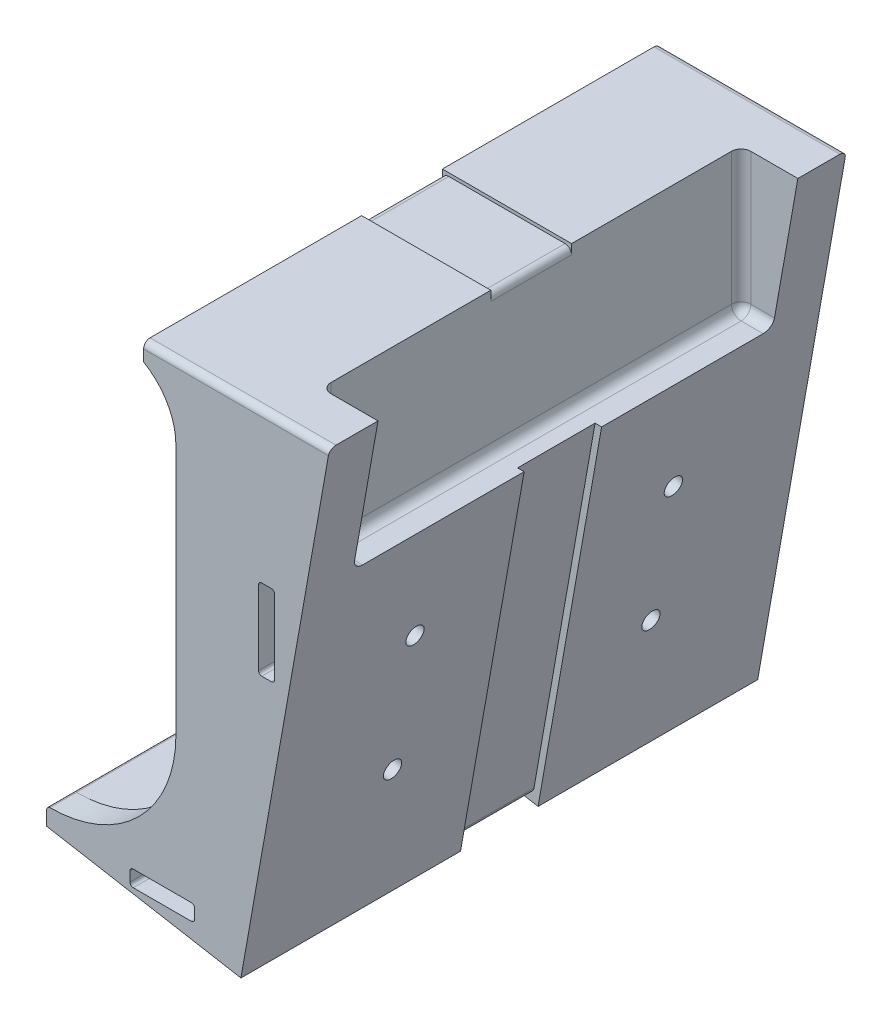
from build123d import *

# Parameters (mm, degrees)
BOSS_EXTRUDE1_DEPTH = 25.400000000000002
SKETCH2_W           = 203.19999999999993
SKETCH2_H           = 184.15
BOSS_EXTRUDE2_DEPTH = 38.1
CHAMFER1_SIZE       = 35.56
CHAMFER1_SIZE_2     = 201.670781506
CUT_EXTRUDE1_DEPTH  = 213.97755620753168
BOSS_EXTRUDE4_DEPTH = 50.800000000000004
FILLET3_R           = 49.53
FILLET4_R           = 1.2699999999999942
BOSS_EXTRUDE5_DEPTH = 203.2
CUT_EXTRUDE2_DEPTH  = 237.8088767802062
FILLET5_R           = 1.2699999999999942
CUT_EXTRUDE3_DEPTH  = 55.88
FILLET6_R           = 3.8099999999999943
SKETCH11_W          = 25.4
SKETCH11_H          = 6.349999999999994
CUT_EXTRUDE4_DEPTH  = 237.8088767802219
FILLET7_R           = 1.2699999999999942
SKETCH12_R          = 3.556000000000007
CUT_EXTRUDE5_DEPTH  = 171.34565336406357
CUT_EXTRUDE6_START  = -3.8099999999999996
SKETCH14_R          = 9.525
SKETCH14_R_2        = 6.350000000000002
CUT_EXTRUDE6_DEPTH  = 167.53565336406356
BOSS_EXTRUDE6_DEPTH = 6.985
FILLET8_R           = 2.54
FILLET9_R           = 25.4
FILLET10_R          = 2.54
FILLET11_START      = -88.646
FILLET11_3_DEPTH    = 177.292
SKETCH17_W          = 5.079999999999998
SKETCH17_H          = 30.480000000000004
CUT_EXTRUDE8_DEPTH  = 230.08767328741837
SKETCH18_W          = 80.83447075011952
SKETCH18_H          = 30.480000000000004
CUT_EXTRUDE9_DEPTH  = 2.54
FILLET12_R          = 2.5399999999999974
SKETCH19_W          = 128.64046005955743
SKETCH19_H          = 31.750000000000004
CUT_EXTRUDE10_DEPTH = 1.27
FILLET13_R          = 2.5399999999999974


with BuildPart() as part:
    # Sketch1 → Boss-Extrude1 (new body)
    with BuildSketch(Plane(origin=(0, 0, 0), x_dir=(0, 0, -1), z_dir=(1, 0, 0))):
        Polygon((-101.6, 92.07500000000002), (101.6, 92.07500000000002), (101.60000000000002, -92.07499999999999), (-101.59999999999997, -92.07499999999999), align=None)
        Polygon((-91.186, 85.09), (91.18599999999998, 85.09), (91.186, -85.09), (-91.18599999999999, -85.09), align=None, mode=Mode.SUBTRACT)
    extrude(amount=BOSS_EXTRUDE1_DEPTH)

    # Sketch2 → Boss-Extrude2 (add)
    with BuildSketch(Plane(origin=(25.400000000000002, 0, 0), x_dir=(0, 0, -1), z_dir=(1, 0, 0))):
        Rectangle(SKETCH2_W, SKETCH2_H)
    extrude(amount=BOSS_EXTRUDE2_DEPTH)

    # Chamfer1
    # the kernel refuses this chamfer: 201.670781506, 35.56 mm, written as the material it takes off along each edge
    with BuildSketch(Plane(origin=(63.5, -92.07499999999999, 625.6493498469063), x_dir=(-1, 0, 0), z_dir=(0, 0, -1))) as chamfer1_piece_1:
        Polygon((CHAMFER1_SIZE, 0), (0, CHAMFER1_SIZE_2), (0, 0), align=None)
    extrude(amount=1251.2986996938125, mode=Mode.SUBTRACT)

    # Sketch4 → Cut-Extrude1 (cut, through all)
    with BuildSketch(Plane(origin=(0, 85.09, 0), x_dir=(-1, 0, 0), z_dir=(0, -1, 0))):
        Polygon((-25.400000000000006, 127.60518613725935), (9.470246053344543, 127.60518613725935), (9.47024605334457, -124.30664499375155), (-25.399999999999977, -124.30664499375155), align=None)
    extrude(amount=-CUT_EXTRUDE1_DEPTH, mode=Mode.SUBTRACT)

    # Sketch7 → Boss-Extrude4 (add)
    with BuildSketch(Plane.ZY):
        Polygon((-101.60000000000002, -92.07499999999999), (101.59999999999997, -92.07499999999999), (101.6, -85.09), (-101.60000000000002, -85.09), align=None)
    extrude(amount=BOSS_EXTRUDE4_DEPTH)

    # Fillet3
    fillet3_edges = [part.edges().sort_by_distance(p)[0] for p in [
        (0, -85.09, -96.393),
        (0, -85.09, 96.393),
    ]]
    fillet(fillet3_edges, radius=FILLET3_R)

    # Fillet4
    fillet4_edges = [part.edges().sort_by_distance(p)[0] for p in [
        (-50.800000000000004, -85.09, -1.421e-14),
    ]]
    fillet(fillet4_edges, radius=FILLET4_R)

    # Sketch8 → Boss-Extrude5 (add)
    with BuildSketch(Plane.XY.offset(101.59999999999998)):
        Polygon((27.939999999998584, -92.07499999999997), (-50.800000000000004, -92.07499999999997), (25.56569848033994, -105.54033304273105), align=None)
    extrude(amount=-BOSS_EXTRUDE5_DEPTH)

    # Sketch9 → Cut-Extrude2 (cut, through all)
    with BuildSketch(Plane.XY.offset(101.59999999999998)):
        Polygon((32.47664065030875, 33.07603424216305), (38.82664065030876, 33.07603424216305), (38.826640650308754, 1.3260342421630433), (32.47664065030875, 1.3260342421630433), align=None)
    extrude(amount=-CUT_EXTRUDE2_DEPTH, mode=Mode.SUBTRACT)

    # Fillet5
    fillet5_edges = [part.edges().sort_by_distance(p)[0] for p in [
        (32.47664065030875, 1.326034242163028, -1.421e-14),
        (32.47664065030875, 33.07603424216303, -1.421e-14),
        (38.82664065030876, 33.07603424216303, -1.421e-14),
        (38.826640650308754, 1.326034242163028, -1.421e-14),
    ]]
    fillet(fillet5_edges, radius=FILLET5_R)

    # Sketch10 → Cut-Extrude3 (cut)
    with BuildSketch(Plane(origin=(0, 92.07500000000002, 0), x_dir=(1, 0, 0), z_dir=(0, 1, 0))):
        Polygon((60.41061349746184, -82.54999999999998), (38.1, -82.55), (38.1, 82.55), (60.41061349746184, 82.55000000000001), align=None)
    extrude(amount=-CUT_EXTRUDE3_DEPTH, mode=Mode.SUBTRACT)

    # Fillet6
    fillet6_edges = [part.edges().sort_by_distance(p)[0] for p in [
        (44.3287309077153, 36.195000000000014, 82.55),
        (38.1, 36.195000000000014, 0),
        (38.1, 64.13500000000002, 82.55),
        (44.3287309077153, 36.195000000000014, -82.55),
        (38.1, 64.13500000000002, -82.55),
    ]]
    fillet(fillet6_edges, radius=FILLET6_R)

    # Sketch11 → Cut-Extrude4 (cut, through all)
    with BuildSketch(Plane(origin=(0, 1.531e-14, -101.60000000000001), x_dir=(-1, 0, 0), z_dir=(0, 1.5e-16, -1))):
        with Locations((5.354907972507771, -92.79969452170296)):
            Rectangle(SKETCH11_W, SKETCH11_H)
    extrude(amount=-CUT_EXTRUDE4_DEPTH, mode=Mode.SUBTRACT)

    # Fillet7
    fillet7_edges = [part.edges().sort_by_distance(p)[0] for p in [
        (-18.05490797250777, -89.62469452170296, -2.842e-14),
        (-18.05490797250777, -95.97469452170296, -2.842e-14),
        (7.345092027492228, -95.97469452170296, -2.842e-14),
        (7.345092027492228, -89.62469452170296, -2.842e-14),
    ]]
    fillet(fillet7_edges, radius=FILLET7_R)

    # Sketch12 → Cut-Extrude5 (cut, through all)
    with BuildSketch(Plane(origin=(42.843258260733016, -7.554422372827925, 0), x_dir=(0, 0, -1), z_dir=(0.9848077530122086, -0.1736481776669275, 0))):
        with Locations(Location((-50.79999999999998, -48.69750128407899, 0), (0, 0, 90))):
            Circle(SKETCH12_R)
        with Locations(Location((50.8, -48.69750128407899, 0), (0, 0, 90))):
            Circle(SKETCH12_R)
        with Locations(Location((-50.79999999999999, 2.102498715921011, 0), (0, 0, 90))):
            Circle(SKETCH12_R)
        with Locations(Location((50.79999999999999, 2.102498715921011, 0), (0, 0, 90))):
            Circle(SKETCH12_R)
    extrude(amount=-CUT_EXTRUDE5_DEPTH, mode=Mode.SUBTRACT)

    # Sketch14 → Cut-Extrude6 (cut, through all)
    with BuildSketch(Plane(origin=(42.843258260733016, -7.554422372827925, 0), x_dir=(0, 0, -1), z_dir=(0.9848077530122086, -0.1736481776669275, 0)).offset(CUT_EXTRUDE6_START)):
        with Locations(Location((50.8, -48.697501284078996, 0), (0, 0, 90))):
            Circle(SKETCH14_R)
        with Locations(Location((50.79999999999999, 2.1024987159210102, 0), (0, 0, 90))):
            Circle(SKETCH14_R_2)
        with Locations(Location((-50.79999999999999, 2.102498715921007, 0), (0, 0, 90))):
            Circle(SKETCH14_R_2)
        with Locations(Location((-50.79999999999998, -48.69750128407899, 0), (0, 0, 90))):
            Circle(SKETCH14_R)
    extrude(amount=-CUT_EXTRUDE6_DEPTH, mode=Mode.SUBTRACT)

    # Sketch15 → Boss-Extrude6 (add)
    with BuildSketch(Plane(origin=(0, 85.09, 0), x_dir=(1, 0, 0), z_dir=(0, 1, 0))):
        Polygon((-12.699999999999998, -101.6), (0, -101.6), (0, -91.186), (0, 101.6), (-12.700000000000001, 101.6), align=None)
        Polygon((0, 101.6), (0, -91.186), (25.39999999999998, -91.18599999999999), (25.400000000000002, 101.6), align=None)
        Polygon((0, -91.186), (0, -101.6), (25.39999999999998, -101.6), (25.39999999999998, -91.18599999999999), align=None)
    extrude(amount=BOSS_EXTRUDE6_DEPTH)

    # Fillet8
    fillet8_edges = [part.edges().sort_by_distance(p)[0] for p in [
        (23.855306748700173, 92.07500000000002, 101.59999999999998),
        (23.855306748700173, 92.07500000000002, -101.6),
    ]]
    fillet(fillet8_edges, radius=FILLET8_R)

    # Fillet9
    # the kernel refuses this fillet: 25.4 mm, written as the material it adds along each edge
    with BuildSketch(Plane(origin=(0, 85.09, -91.18599999999998), x_dir=(-1, -7.273e-14, 0), z_dir=(0, 0, -1))) as fillet9_piece_1:
        with BuildLine():
            CenterArc((25.4000000000016, -21.99704525612413), FILLET9_R, 120.00000000000277, 60.00000000000142)
            Line((1.5999e-12, -21.99704525612598), (-0.5079999999984001, -21.997045256126015))
            Line((-0.5079999999984001, -21.997045256126015), (-0.508, -3.695e-14))
            Line((-0.508, -3.695e-14), (-3.695e-14, 0.5079999999999956))
            ThreePointArc((-3.695e-14, 0.5079999999999956), (6.350000000000231, 0.5080000000004574), (12.446000000000515, 0.43994090512247935))
            Line((12.446000000000515, 0.43994090512247935), (12.700000000000536, 0))
        make_face()
    extrude(amount=10.41400000000003)
    with BuildSketch(Plane(origin=(0, 85.09, 101.60000000000001), x_dir=(-1, -7.385e-14, 0), z_dir=(0, 0, -1))) as fillet9_piece_2:
        with BuildLine():
            CenterArc((25.400000000001626, -21.997045256124103), FILLET9_R, 120.00000000000287, 60.000000000001364)
            Line((1.62452e-12, -21.99704525612598), (-0.5079999999983755, -21.997045256126018))
            Line((-0.5079999999983755, -21.997045256126018), (-0.508, -3.752e-14))
            Line((-0.508, -3.752e-14), (-3.752e-14, 0.5079999999999956))
            ThreePointArc((-3.752e-14, 0.5079999999999956), (6.35000000000023, 0.5080000000004645), (12.446000000000513, 0.4399409051224791))
            Line((12.446000000000513, 0.4399409051224791), (12.700000000000534, 0))
        make_face()
    extrude(amount=10.414000000000001)

    # Fillet10
    # the kernel refuses this fillet: 2.54 mm, written as the material it adds along each edge
    with BuildSketch(Plane(origin=(31.749999999999982, 85.09, -91.18599999999998), x_dir=(-7.5e-16, -1.119e-14, 1), z_dir=(-1, 1.12e-15, -7.5e-16))) as fillet10_piece_1_section:
        with BuildLine():
            CenterArc((FILLET10_R, -FILLET10_R), FILLET10_R, 90.00000000000065, 89.99999999999935)
            Line((1.421e-14, -FILLET10_R), (0, 0))
            Line((0, 0), (FILLET10_R, 0))
        make_face()
    fillet10_piece_1 = extrude(amount=44.45000000000091, mode=Mode.PRIVATE)
    fillet10_piece_1 = fillet10_piece_1 - Plane(origin=(-25.400000000002, 63.09295474387601, -91.18599999999998), x_dir=(-1, 0, 0), z_dir=(0, 0, 1)) * Cylinder(25.4, 100, mode=Mode.PRIVATE)
    add(fillet10_piece_1)
    with BuildSketch(Plane(origin=(31.750000000000018, 85.09, 91.186), x_dir=(3.7e-16, -1.119e-14, -1), z_dir=(-1, 1.12e-15, -3.7e-16))) as fillet10_piece_2_section:
        with BuildLine():
            CenterArc((FILLET10_R, FILLET10_R), FILLET10_R, 180, 89.99999999999932)
            Line((2.842e-14, FILLET10_R), (0, 0))
            Line((0, 0), (FILLET10_R, 0))
        make_face()
    fillet10_piece_2 = extrude(amount=44.45000000000095, mode=Mode.PRIVATE)
    fillet10_piece_2 = fillet10_piece_2 - Plane(origin=(-25.400000000002, 63.09295474387601, 91.186), x_dir=(-1, 0, 0), z_dir=(0, 0, 1)) * Cylinder(25.4, 100, mode=Mode.PRIVATE)
    add(fillet10_piece_2)

    # Fillet11: read off the stored shape, not the designer's step
    # Fillet11 outline → Fillet11 (revolve, cut)
    with BuildSketch(Plane(origin=(0, 82.55, -88.646), x_dir=(0, 1, 0), z_dir=(0, 0, -1))):
        with BuildLine():
            Line((2.54, -12.7), (5.08, -12.7))
            ThreePointArc((5.08, -12.7), (3.283948776, -11.956051224), (2.54, -10.16))
            Line((2.54, -10.16), (2.54, -12.7))
        make_face()
    revolve(axis=Axis((0, 82.55, -88.646), (1, 0, 0)), mode=Mode.SUBTRACT)

    # Fillet11 2 outline → Fillet11 2 (revolve, cut)
    with BuildSketch(Plane(origin=(0, 82.55, 88.646), x_dir=(0, 1, 0), z_dir=(0, 0, -1))):
        with BuildLine():
            Line((2.54, -12.7), (5.08, -12.7))
            ThreePointArc((5.08, -12.7), (3.283948776, -11.956051224), (2.54, -10.16))
            Line((2.54, -10.16), (2.54, -12.7))
        make_face()
    revolve(axis=Axis((0, 82.55, 88.646), (1, 0, 0)), mode=Mode.SUBTRACT)

    # Fillet11 3 outline → Fillet11 3 (cut)
    with BuildSketch(Plane.XY.offset(FILLET11_START)):
        with BuildLine():
            ThreePointArc((-10.16, 85.09), (-11.956051224, 85.833948776), (-12.7, 87.63))
            Line((-12.7, 87.63), (-12.7, 85.09))
            Line((-12.7, 85.09), (-10.16, 85.09))
        make_face()
    extrude(amount=FILLET11_3_DEPTH, mode=Mode.SUBTRACT)

    # Sketch17 → Cut-Extrude8 (cut, through all)
    with BuildSketch(Plane(origin=(-17.277559780393045, -97.98591066990319, 0), x_dir=(0.9848077530122087, -0.17364817766692695, 0), z_dir=(-0.17364817766692695, -0.9848077530122088, 0))):
        with Locations((43.504184577842025, -4.44e-15)):
            Rectangle(SKETCH17_W, SKETCH17_H)
    extrude(amount=-CUT_EXTRUDE8_DEPTH, mode=Mode.SUBTRACT)

    # Sketch18 → Cut-Extrude9 (cut)
    with BuildSketch(Plane(origin=(-17.277559780393045, -97.98591066990319, 0), x_dir=(0.9848077530122087, -0.17364817766692695, 0), z_dir=(-0.17364817766692695, -0.9848077530122088, 0))):
        with Locations((0.5469492027822476, -4.44e-15)):
            Rectangle(SKETCH18_W, SKETCH18_H)
    extrude(amount=-CUT_EXTRUDE9_DEPTH, mode=Mode.SUBTRACT)

    # Fillet12
    fillet12_edges = [part.edges().sort_by_distance(p)[0] for p in [
        (23.50535315896292, -102.59785497880608, -5.33e-15),
    ]]
    fillet(fillet12_edges, radius=FILLET12_R)

    # Sketch19 → Cut-Extrude10 (cut)
    with BuildSketch(Plane(origin=(0, 92.07500000000002, 0), x_dir=(1, 0, 0), z_dir=(0, 1, 0))):
        Rectangle(SKETCH19_W, SKETCH19_H)
    extrude(amount=-CUT_EXTRUDE10_DEPTH, mode=Mode.SUBTRACT)

    # Fillet13
    fillet13_edges = [part.edges().sort_by_distance(p)[0] for p in [
        (-12.7, 90.80500000000002, 0),
        (38.1, 90.80500000000002, 0),
    ]]
    fillet(fillet13_edges, radius=FILLET13_R)


solid = part.part
